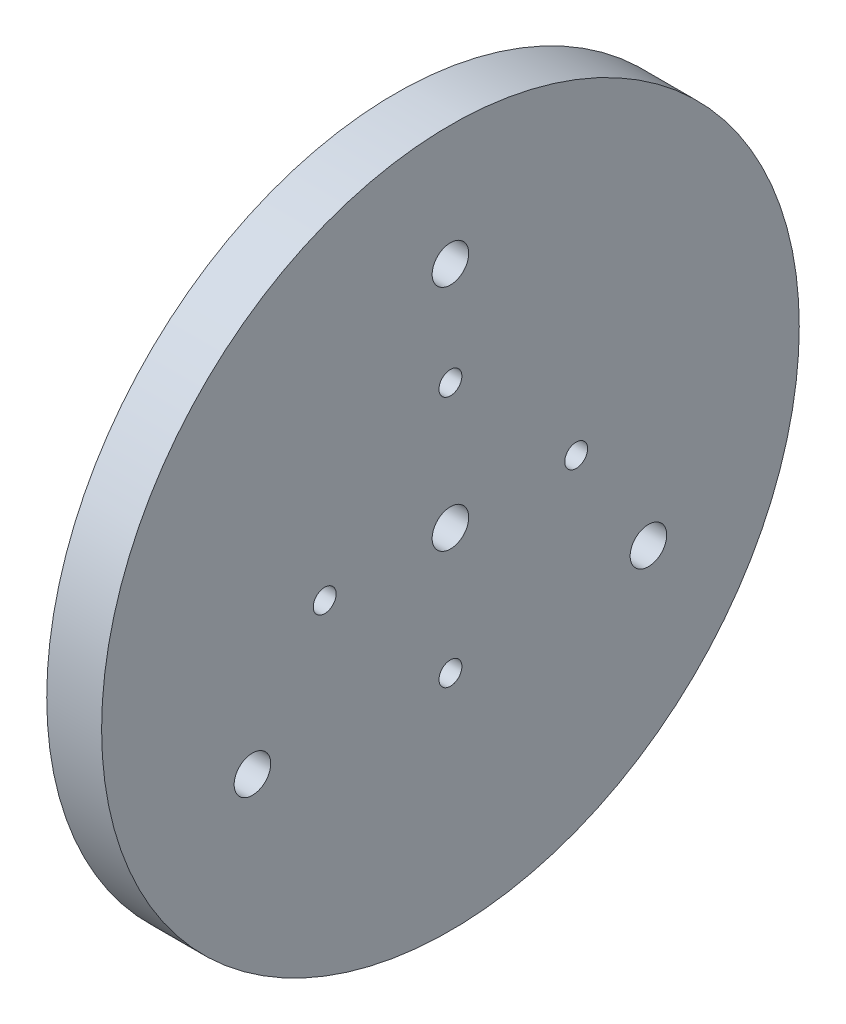
from build123d import *

# Parameters (mm, degrees)
SKETCH2_R           = 76.29
SKETCH2_R_2         = 2.5
SKETCH2_R_3         = 4
BOSS_EXTRUDE1_DEPTH = 12


with BuildPart() as part:
    # Sketch2 → Boss-Extrude1 (new body)
    with BuildSketch(Plane(origin=(0, 0, 0), x_dir=(0, 0, -1), z_dir=(1, 0, 0))):
        Circle(SKETCH2_R)
        with Locations((0, 27.5)):
            Circle(SKETCH2_R_2, mode=Mode.SUBTRACT)
        with Locations((27.5, 0)):
            Circle(SKETCH2_R_2, mode=Mode.SUBTRACT)
        with Locations((0, -27.5)):
            Circle(SKETCH2_R_2, mode=Mode.SUBTRACT)
        with Locations((-27.5, 0)):
            Circle(SKETCH2_R_2, mode=Mode.SUBTRACT)
        with Locations((0, 50)):
            Circle(SKETCH2_R_3, mode=Mode.SUBTRACT)
        with Locations((43.301270189, -25)):
            Circle(SKETCH2_R_3, mode=Mode.SUBTRACT)
        with Locations((-43.301270189, -25)):
            Circle(SKETCH2_R_3, mode=Mode.SUBTRACT)
        Circle(SKETCH2_R_3, mode=Mode.SUBTRACT)
    extrude(amount=BOSS_EXTRUDE1_DEPTH)


solid = part.part
